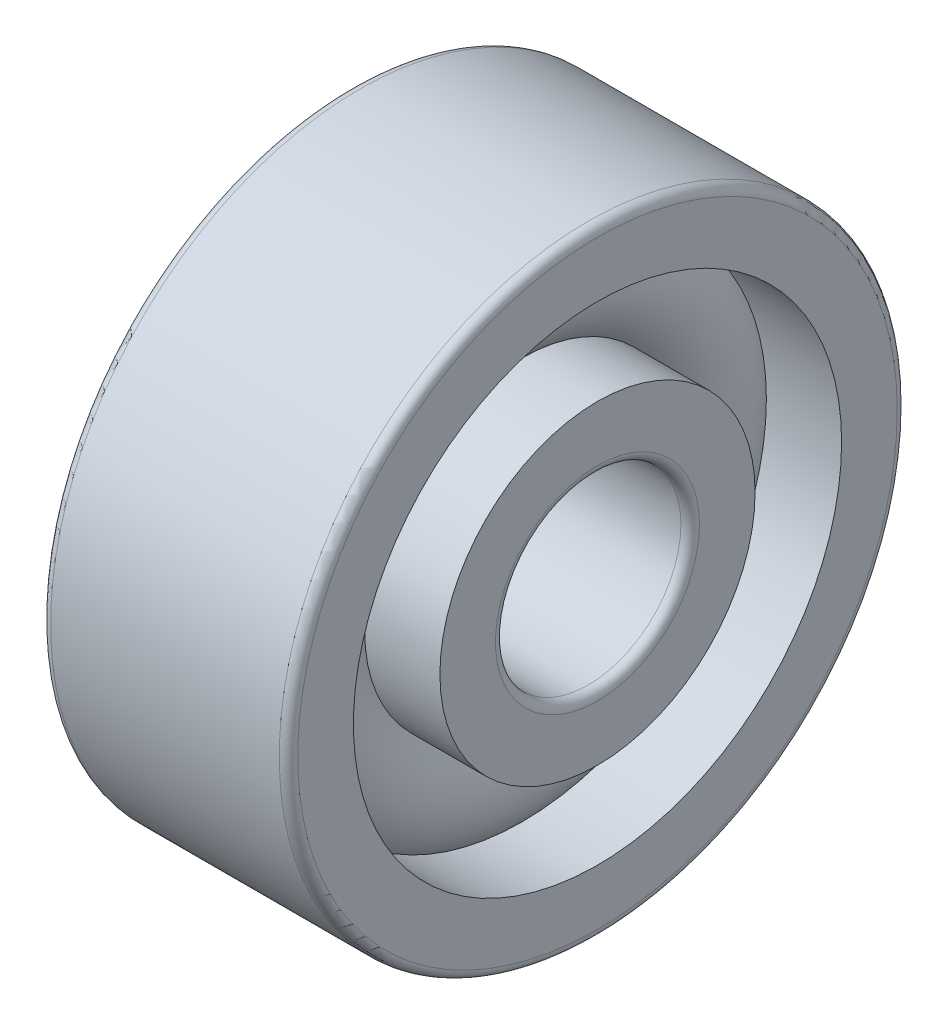
from build123d import *

# Parameters (mm, degrees)
CAGSPISKE_W     = 0.21
CAGSPISKE_H     = 0.35
CAGESPINE_ANGLE = 0.001
BALSIMSKE_R     = 1.05


with BuildPart() as part:
    # CagSpiSke → CageSpine (revolve)
    with BuildSketch(Plane.XY):
        with Locations((0, 3.25)):
            Rectangle(CAGSPISKE_W, CAGSPISKE_H)
    revolve(axis=Axis((-20.6375, 0, 0), (-1, 0, 0)), revolution_arc=CAGESPINE_ANGLE)

    # BalSimSke → BallsSimplified (revolve)
    with BuildSketch(Plane.XY):
        with Locations((0, 3.25)):
            Circle(BALSIMSKE_R)
    revolve(axis=Axis((-10, 0, 0), (1, 0, 0)))

    # InnRacSke → InnerRace (revolve)
    with BuildSketch(Plane.XY):
        with BuildLine():
            Line((-0.748748957, 2.55), (-2, 2.55))
            Line((-2, 2.55), (-2, 1.65))
            ThreePointArc((-2, 1.65), (-1.956066017, 1.543933983), (-1.85, 1.5))
            Line((-1.85, 1.5), (1.85, 1.5))
            ThreePointArc((1.85, 1.5), (1.956066017, 1.543933983), (2, 1.65))
            Line((2, 1.65), (2, 2.55))
            Line((2, 2.55), (0.748748957, 2.55))
            ThreePointArc((0.748748957, 2.55), (0, 2.225), (-0.748748957, 2.55))
        make_face()
    revolve(axis=Axis((-20.6375, 0, 0), (1, 0, 0)))

    # OutRacSke → OuterRace (revolve)
    with BuildSketch(Plane.XY):
        with BuildLine():
            Line((-0.748748957, 3.95), (-2, 3.95))
            Line((-2, 3.95), (-2, 4.85))
            ThreePointArc((-2, 4.85), (-1.956066017, 4.956066017), (-1.85, 5))
            Line((-1.85, 5), (1.85, 5))
            ThreePointArc((1.85, 5), (1.956066017, 4.956066017), (2, 4.85))
            Line((2, 4.85), (2, 3.95))
            Line((2, 3.95), (0.748748957, 3.95))
            ThreePointArc((0.748748957, 3.95), (0, 4.275), (-0.748748957, 3.95))
        make_face()
    revolve(axis=Axis((-20.6375, 0, 0), (1, 0, 0)))


solid = part.part
